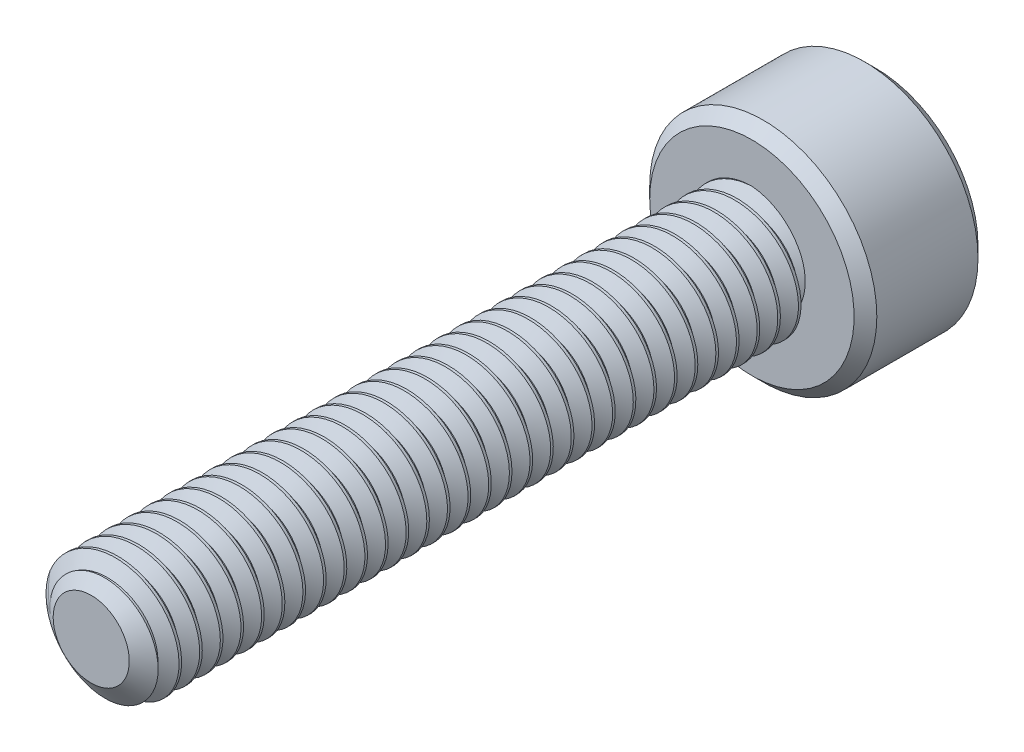
from build123d import *

# Parameters (mm, degrees)
SKETCH1_R          = 1.5
EXTRUDE1_DEPTH     = 16
CUT_SWEEP1_PITCH   = 0.5
SKETCH6_R          = 2.75
EXTRUDE2_DEPTH     = 3
CUT_EXTRUDE1_DEPTH = 1.875
CHAMFER1_SIZE      = 0.275


with BuildPart() as part:
    # Sketch1 → Extrude1 (new body)
    with BuildSketch(Plane.XY):
        Circle(SKETCH1_R)
    extrude(amount=-EXTRUDE1_DEPTH)

    # Cut-Sweep1: the profile of Sketch3 profile screwed along a right-hand helix of 33 turns, 6 arcs to a turn; built about Z, then put on its axis
    cut_sweep1_z = Axis((0, 0, 0), (0, 0, 1))
    cut_sweep1_corners = [(1.5003, 0, -0.437673205), (1.175240474, 0, -0.25), (1.175240474, 0, -0.1875), (1.5003, 0, 0.000173205)]
    with BuildLine(mode=Mode.PRIVATE) as cut_sweep1_profile:
        Line(cut_sweep1_corners[0], cut_sweep1_corners[1])
        Line(cut_sweep1_corners[1], cut_sweep1_corners[2])
        Line(cut_sweep1_corners[2], cut_sweep1_corners[3])
        Line(cut_sweep1_corners[3], cut_sweep1_corners[0])
    cut_sweep1_cap = Face(cut_sweep1_profile.wire())
    cut_sweep1_turn_angles = [0, 30, 60, 90, 120, 150, 180, 210, 240, 270, 300, 330, 360]
    cut_sweep1_turn_weights = [1, 0.8660254037844387, 1, 0.8660254037844387, 1, 0.8660254037844387, 1, 0.8660254037844387, 1, 0.8660254037844387, 1, 0.8660254037844387, 1]
    cut_sweep1_turn_rails = [Edge.make_bspline([Vector(p[0], p[1], 0).rotate(cut_sweep1_z, cut_sweep1_turn_angles[k]) / cut_sweep1_turn_weights[k] + Vector(0, 0, p[2] + CUT_SWEEP1_PITCH * cut_sweep1_turn_angles[k] / 360) for k in range(13)], [0, 0, 0, 1, 1, 2, 2, 3, 3, 4, 4, 5, 5, 6, 6, 6], 2, cut_sweep1_turn_weights) for p in cut_sweep1_corners]
    cut_sweep1_turn_sides = [Face.make_surface_from_curves(cut_sweep1_turn_rails[p[0]], cut_sweep1_turn_rails[p[1]]) for p in [(0, 1), (1, 2), (2, 3), (3, 0)]]
    cut_sweep1 = Plane(origin=(0, 0, 0), x_dir=(0, 1, 0), z_dir=(0, 0, -1)) * Solid(Shell([*[p.moved(Location((0, 0, CUT_SWEEP1_PITCH * i))) for i in range(33) for p in cut_sweep1_turn_sides], cut_sweep1_cap, cut_sweep1_cap.rotate(cut_sweep1_z, 11880).moved(Location((0, 0, CUT_SWEEP1_PITCH * 11880 / 360)))]))
    add(cut_sweep1, mode=Mode.SUBTRACT)

    # Sketch4 → Cut-Revolve1 (revolve, cut)
    with BuildSketch(Plane(origin=(0, 0, 0), x_dir=(0, 0, -1), z_dir=(1, 0, 0)), mode=Mode.PRIVATE) as cut_revolve1_sk:
        Polygon((0.405251783, 1.5), (0, 0.921240474), (0, 1.5), align=None)
    revolve(cut_revolve1_sk.sketch.rotate(Axis((0, 0, 0), (0, 0, -1)), 263.352109169), axis=Axis((0, 0, 0), (0, 0, -1)), mode=Mode.SUBTRACT)

    # Sketch6 → Extrude2 (add)
    with BuildSketch(Plane(origin=(0, 0, -16), x_dir=(-1, 0, 0), z_dir=(0, 0, -1))):
        Circle(SKETCH6_R)
    extrude(amount=EXTRUDE2_DEPTH)

    # Sketch7 → Cut-Extrude1 (cut)
    with BuildSketch(Plane(origin=(0, 0, -19), x_dir=(-1, 0, 0), z_dir=(0, 0, -1))):
        Polygon((0, 1.443375673), (-1.25, 0.721687836), (-1.25, -0.721687836), (0, -1.443375673), (1.25, -0.721687836), (1.25, 0.721687836), align=None)
    extrude(amount=-CUT_EXTRUDE1_DEPTH, mode=Mode.SUBTRACT)

    # Cut-Extrude2 cone 1 section (through the dimple's axis) → Cut-Extrude2 (revolve, cut)
    with BuildSketch(Plane(origin=(0, 0, -19), x_dir=(0, 1, 0), z_dir=(1, 0, 0))):
        Polygon((0, 0), (1.443375673, 0), (0, 1.443375673), align=None)
    revolve(axis=Axis((0, 0, -19), (0, 0, 1)), mode=Mode.SUBTRACT)

    # Chamfer1
    chamfer1_edges = [part.edges().sort_by_distance(p)[0] for p in [
        (2.75, 0, -16),
        (2.75, 0, -19),
    ]]
    chamfer(chamfer1_edges, length=CHAMFER1_SIZE)


solid = part.part
